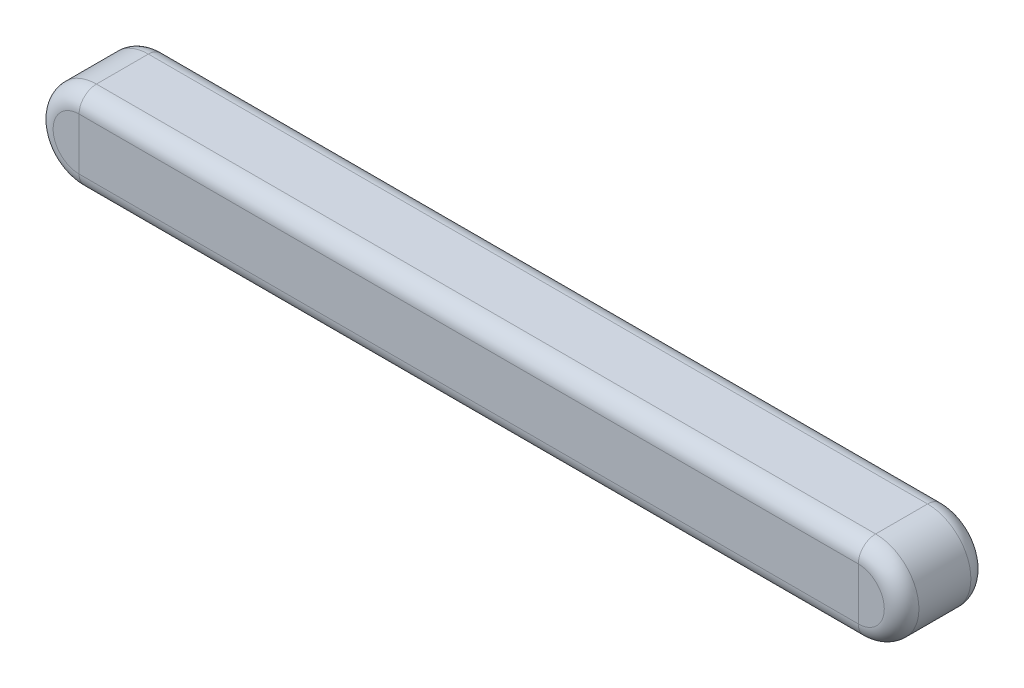
from build123d import *

# Parameters (mm, degrees)
BOSS_EXTRUDE1_DEPTH = 12.7
SKETCH2_R           = 4.7625
CUT_EXTRUDE1_DEPTH  = 6.35
FILLET1_R           = 2.54


with BuildPart() as part:
    # Sketch1 → Boss-Extrude1 (new body)
    with BuildSketch(Plane.XY):
        with BuildLine():
            Line((0, 0), (114.3, 0))
            ThreePointArc((114.3, 0), (120.65, -6.35), (114.3, -12.7))
            Line((114.3, -12.7), (0, -12.7))
            ThreePointArc((0, -12.7), (-6.35, -6.35), (0, 0))
        make_face()
    extrude(amount=-BOSS_EXTRUDE1_DEPTH)

    # Sketch2 → Cut-Extrude1 (cut)
    with BuildSketch(Plane(origin=(0, 0, -12.7), x_dir=(-1, 0, 0), z_dir=(0, 0, -1))):
        with Locations((-6.985, -6.35)):
            Circle(SKETCH2_R)
        with Locations((-107.315, -6.35)):
            Circle(SKETCH2_R)
    extrude(amount=-CUT_EXTRUDE1_DEPTH, mode=Mode.SUBTRACT)

    # Fillet1
    # the kernel refuses this fillet: 2.54 mm, written as the material it takes off along each edge
    with BuildSketch(Plane(origin=(114.3, -6.35, -12.7), x_dir=(0, 1, 0), z_dir=(-1, 0, 0))) as fillet1_piece_1:
        with BuildLine():
            CenterArc((6.35 - FILLET1_R, -FILLET1_R), FILLET1_R, 0, 90)
            Line((6.35 - FILLET1_R, 0), (6.35, 0))
            Line((6.35, 0), (6.35, -FILLET1_R))
        make_face()
    revolve(axis=Axis((114.3, -6.35, -12.7), (0, 0, -1)), revolution_arc=180, mode=Mode.SUBTRACT)
    with BuildSketch(Plane(origin=(0, 0, -12.7), x_dir=(0, -1, 0), z_dir=(1, 0, 0)), Plane(origin=(114.3, -12.7, 0), x_dir=(0, 0, -1), z_dir=(-1, 0, 0))) as fillet1_piece_2:
        with BuildLine():
            CenterArc((FILLET1_R, -FILLET1_R), FILLET1_R, 90, 90)
            Line((0, -FILLET1_R), (0, 0))
            Line((0, 0), (FILLET1_R, 0))
        make_face()
    extrude(amount=114.3, mode=Mode.SUBTRACT)
    with BuildSketch(Plane(origin=(0, -6.35, -12.7), x_dir=(0, -1, 0), z_dir=(1, 0, 0))) as fillet1_piece_3:
        with BuildLine():
            CenterArc((6.35 - FILLET1_R, -FILLET1_R), FILLET1_R, 0, 90)
            Line((6.35 - FILLET1_R, 0), (6.35, 0))
            Line((6.35, 0), (6.35, -FILLET1_R))
        make_face()
    revolve(axis=Axis((0, -6.35, -12.7), (0, 0, -1)), revolution_arc=180, mode=Mode.SUBTRACT)
    with BuildSketch(Plane(origin=(0, 0, 0), x_dir=(0, -1, 0), z_dir=(1, 0, 0)), Plane(origin=(114.3, -12.7, -12.7), x_dir=(0, 0, 1), z_dir=(-1, 0, 0))) as fillet1_piece_4:
        with BuildLine():
            CenterArc((FILLET1_R, FILLET1_R), FILLET1_R, 180, 90)
            Line((0, FILLET1_R), (0, 0))
            Line((0, 0), (FILLET1_R, 0))
        make_face()
    extrude(amount=114.3, mode=Mode.SUBTRACT)
    with BuildSketch(Plane(origin=(114.3, -6.35, 0), x_dir=(0, 1, 0), z_dir=(-1, 0, 0))) as fillet1_piece_5:
        with BuildLine():
            CenterArc((6.35 - FILLET1_R, FILLET1_R), FILLET1_R, 270, 90)
            Line((6.35 - FILLET1_R, 0), (6.35, 0))
            Line((6.35, 0), (6.35, FILLET1_R))
        make_face()
    revolve(axis=Axis((114.3, -6.35, 0), (0, 0, -1)), revolution_arc=180, mode=Mode.SUBTRACT)
    with BuildSketch(Plane(origin=(0, -6.35, 0), x_dir=(0, -1, 0), z_dir=(1, 0, 0))) as fillet1_piece_6:
        with BuildLine():
            CenterArc((6.35 - FILLET1_R, FILLET1_R), FILLET1_R, 270, 90)
            Line((6.35 - FILLET1_R, 0), (6.35, 0))
            Line((6.35, 0), (6.35, FILLET1_R))
        make_face()
    revolve(axis=Axis((0, -6.35, 0), (0, 0, -1)), revolution_arc=180, mode=Mode.SUBTRACT)


solid = part.part
